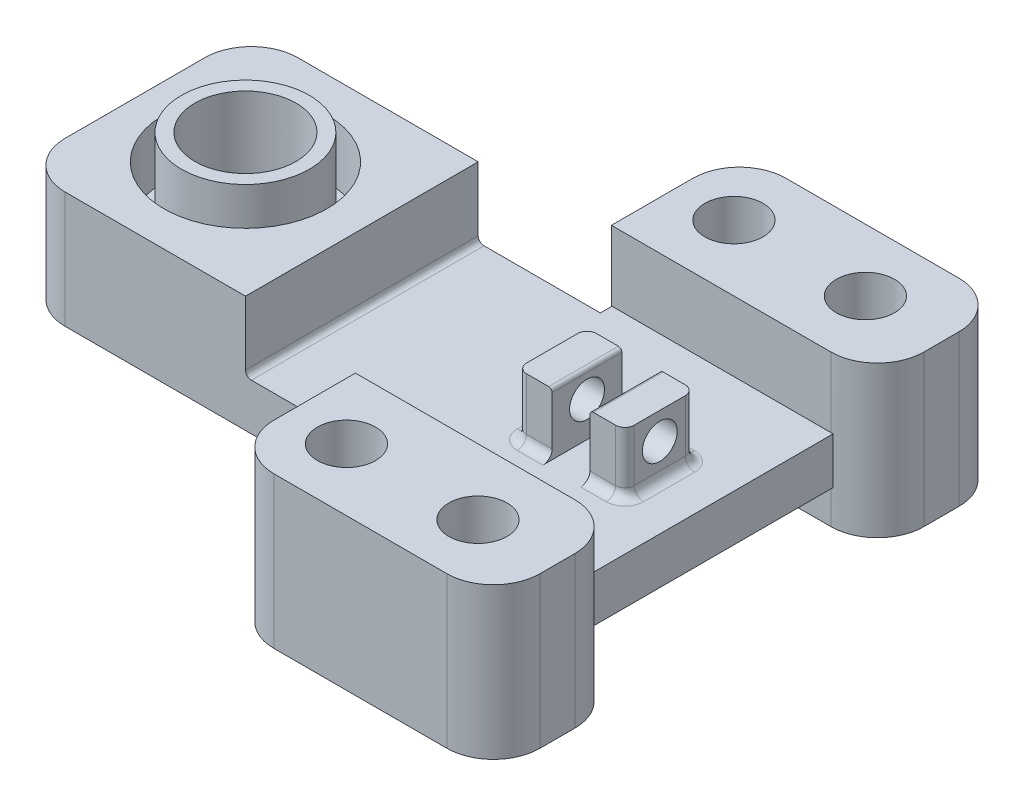
from build123d import *

# Parameters (mm, degrees)
SKETCH2_W            = 49
SKETCH2_H            = 20
BOSS_EXTRUDE1_DEPTH  = 10
SKETCH3_W            = 30
SKETCH3_H            = 3.02
CUT_EXTRUDE1_DEPTH   = 2
SKETCH4_W            = 5
SKETCH4_H            = 6
CUT_EXTRUDE2_DEPTH   = 5
SKETCH5_R            = 7
CUT_EXTRUDE3_DEPTH   = 38.474986727
SKETCH12_W           = 5
SKETCH12_H           = 6
BOSS_EXTRUDE4_DEPTH  = 0.8
SKETCH14_W           = 29.5
SKETCH14_H           = 6
CUT_EXTRUDE6_DEPTH   = 42.177221974
SKETCH20_W           = 5
SKETCH20_H           = 6
BOSS_EXTRUDE6_DEPTH  = 4.2
SKETCH21_R           = 4.6
CUT_EXTRUDE8_DEPTH   = 0.5
SKETCH22_R           = 3.825
CUT_EXTRUDE9_DEPTH   = 4
SKETCH24_R           = 4.6
SKETCH24_R_2         = 4.25
CUT_EXTRUDE11_DEPTH  = 1
BOSS_EXTRUDE9_START  = 0.5
SKETCH26_R           = 4.25
SKETCH26_R_2         = 3.825
BOSS_EXTRUDE9_DEPTH  = 0.5
SKETCH27_R           = 7
SKETCH27_R_2         = 4.6
CUT_EXTRUDE12_DEPTH  = 1
FILLET1_R            = 0.5
SKETCH56_R           = 2
CUT_EXTRUDE13_DEPTH  = 2
SKETCH57_W           = 3
SKETCH57_H           = 6
BOSS_EXTRUDE19_DEPTH = 5.3
CUT_EXTRUDE14_REACH  = 50.148
SKETCH58_R           = 1.5
FILLET2_R            = 0.3
FILLET3_R            = 0.8
SKETCH60_W           = 19
SKETCH60_H           = 4
BOSS_EXTRUDE21_DEPTH = 1
SKETCH59_W           = 22.86
SKETCH59_H           = 13
BOSS_EXTRUDE20_DEPTH = 11
CUT_EXTRUDE15_REACH  = 49.914
SKETCH61_R           = 2.5
FILLET4_R            = 4
SKETCH65_R           = 7
SKETCH65_R_2         = 4.25
BOSS_EXTRUDE24_DEPTH = 1
CUT_EXTRUDE17_REACH  = 48.805
SKETCH66_R           = 4.35
BOSS_EXTRUDE25_START = 7.2
SKETCH67_R           = 5.5
SKETCH67_R_2         = 4.35
BOSS_EXTRUDE25_DEPTH = 7.2


with BuildPart() as part:
    # Sketch2 → Boss-Extrude1 (new body)
    with BuildSketch(Plane(origin=(0, 0, 0), x_dir=(1, 0, 0), z_dir=(0, 1, 0))):
        with Locations((10.076923077, 3.557692308)):
            Rectangle(SKETCH2_W, SKETCH2_H)
    extrude(amount=BOSS_EXTRUDE1_DEPTH)

    # Sketch3 → Cut-Extrude1 (cut)
    with BuildSketch(Plane.XZ):
        with Locations((12.576923077, -3.557692308)):
            Rectangle(SKETCH3_W, SKETCH3_H)
    extrude(amount=-CUT_EXTRUDE1_DEPTH, mode=Mode.SUBTRACT)

    # Sketch4 → Cut-Extrude2 (cut)
    with BuildSketch(Plane.XZ):
        with Locations((-4.923076923, -3.547692308)):
            Rectangle(SKETCH4_W, SKETCH4_H)
    extrude(amount=-CUT_EXTRUDE2_DEPTH, mode=Mode.SUBTRACT)

    # Sketch5 → Cut-Extrude3 (cut, through all)
    with BuildSketch(Plane.XZ.offset(-5)):
        with Locations(Location((-4.923076923, -3.552692308, 0), (0, 0, 270))):
            Circle(SKETCH5_R)
    extrude(amount=-CUT_EXTRUDE3_DEPTH, mode=Mode.SUBTRACT)

    # Sketch12 → Boss-Extrude4 (add)
    with BuildSketch(Plane.XZ):
        with Locations((-4.923076923, -3.547692308)):
            Rectangle(SKETCH12_W, SKETCH12_H)
    extrude(amount=-BOSS_EXTRUDE4_DEPTH)

    # Sketch14 → Cut-Extrude6 (cut, through all)
    with BuildSketch(Plane.XY.offset(6.442307692)):
        with Locations((19.826923077, 7)):
            Rectangle(SKETCH14_W, SKETCH14_H)
    extrude(amount=-CUT_EXTRUDE6_DEPTH, mode=Mode.SUBTRACT)

    # Sketch20 → Boss-Extrude6 (add)
    with BuildSketch(Plane(origin=(0, 0.8, 0), x_dir=(1, 0, 0), z_dir=(0, 1, 0))):
        with Locations((-4.923076923, 3.547692308)):
            Rectangle(SKETCH20_W, SKETCH20_H)
    extrude(amount=BOSS_EXTRUDE6_DEPTH)

    # Sketch21 → Cut-Extrude8 (cut)
    with BuildSketch(Plane(origin=(0, 5, 0), x_dir=(1, 0, 0), z_dir=(0, 1, 0))):
        with Locations(Location((-4.923076923, 3.552692308, 0), (0, 0, 270))):
            Circle(SKETCH21_R)
    extrude(amount=-CUT_EXTRUDE8_DEPTH, mode=Mode.SUBTRACT)

    # Sketch22 → Cut-Extrude9 (cut)
    with BuildSketch(Plane(origin=(0, 4.5, 0), x_dir=(1, 0, 0), z_dir=(0, 1, 0))):
        with Locations(Location((-4.923076923, 3.552692308, 0), (0, 0, 270))):
            Circle(SKETCH22_R)
    extrude(amount=-CUT_EXTRUDE9_DEPTH, mode=Mode.SUBTRACT)

    # Sketch24 → Cut-Extrude11 (cut)
    with BuildSketch(Plane(origin=(0, 5, 0), x_dir=(1, 0, 0), z_dir=(0, 1, 0))):
        with Locations(Location((-4.923076923, 3.552692308, 0), (0, 0, 270))):
            Circle(SKETCH24_R)
        with Locations(Location((-4.923076923, 3.552692308, 0), (0, 0, 270))):
            Circle(SKETCH24_R_2, mode=Mode.SUBTRACT)
    extrude(amount=-CUT_EXTRUDE11_DEPTH, mode=Mode.SUBTRACT)

    # Sketch26 → Boss-Extrude9 (add)
    with BuildSketch(Plane(origin=(0, 4.5, 0), x_dir=(1, 0, 0), z_dir=(0, 1, 0)).offset(BOSS_EXTRUDE9_START)):
        with Locations(Location((-4.923076923, 3.552692308, 0), (0, 0, 270))):
            Circle(SKETCH26_R)
        with Locations(Location((-4.923076923, 3.552692308, 0), (0, 0, 270))):
            Circle(SKETCH26_R_2, mode=Mode.SUBTRACT)
    extrude(amount=-BOSS_EXTRUDE9_DEPTH)

    # Sketch27 → Cut-Extrude12 (cut)
    with BuildSketch(Plane(origin=(0, 5, 0), x_dir=(1, 0, 0), z_dir=(0, 1, 0))):
        with Locations(Location((-4.923076923, 3.552692308, 0), (0, 0, 90))):
            Circle(SKETCH27_R)
        with Locations((-4.923076923, 3.552692308)):
            Circle(SKETCH27_R_2, mode=Mode.SUBTRACT)
    extrude(amount=-CUT_EXTRUDE12_DEPTH, mode=Mode.SUBTRACT)

    # Fillet1
    fillet1_edges = [part.edges().sort_by_distance(p)[0] for p in [
        (5.076923077, 4, -3.557692308),
    ]]
    fillet(fillet1_edges, radius=FILLET1_R)

    # Sketch56 → Cut-Extrude13 (cut)
    with BuildSketch(Plane.XZ):
        with Locations((28.926923077, -3.557692308)):
            Circle(SKETCH56_R)
    extrude(amount=-CUT_EXTRUDE13_DEPTH, mode=Mode.SUBTRACT)

    # Sketch57 → Boss-Extrude19 (add)
    with BuildSketch(Plane(origin=(0, 4, 0), x_dir=(1, 0, 0), z_dir=(0, 1, 0))):
        with Locations((29.181923077, 3.557692308)):
            Rectangle(SKETCH57_W, SKETCH57_H)
        with Locations((22.931923077, 3.557692308)):
            Rectangle(SKETCH57_W, SKETCH57_H)
    extrude(amount=BOSS_EXTRUDE19_DEPTH)

    # Cut-Extrude14: up to this face of the body (flat: up to its plane)
    cut_extrude14_end = Plane(part.part.faces().sort_by_distance((21.431923077, 6.65, -3.557692308))[0])
    # Sketch58 → Cut-Extrude14 (cut, up to the picked face)
    with BuildSketch(Plane(origin=(30.681923077, 0, 0), x_dir=(0, 0, -1), z_dir=(1, 0, 0)), mode=Mode.PRIVATE) as cut_extrude14_sk1:
        with Locations(Location((3.557692308, 7, 0), (0, 0, 180))):
            Circle(SKETCH58_R)
    cut_extrude14_tool1 = split(extrude(cut_extrude14_sk1.sketch, amount=-CUT_EXTRUDE14_REACH, mode=Mode.PRIVATE), bisect_by=cut_extrude14_end, keep=Keep.BOTH, mode=Mode.PRIVATE)
    add(cut_extrude14_tool1.solids().sort_by(Axis((30.681923, 7, -3.557692), (-1, 0, 0)))[0], mode=Mode.SUBTRACT)

    # Fillet2
    fillet2_edges = [part.edges().sort_by_distance(p)[0] for p in [
        (27.681923077, 9.3, -3.557692308),
        (24.431923077, 9.3, -3.557692308),
    ]]
    fillet(fillet2_edges, radius=FILLET2_R)

    # Fillet3
    fillet3_edges = [part.edges().sort_by_distance(p)[0] for p in [
        (30.681923077, 4, -3.557692308),
        (30.681923077, 6.65, -0.557692308),
        (29.181923077, 4, -6.557692308),
        (30.681923077, 6.65, -6.557692308),
        (29.181923077, 4, -0.557692308),
        (21.431923077, 6.65, -6.557692308),
        (21.431923077, 6.65, -0.557692308),
        (22.931923077, 4, -6.557692308),
        (21.431923077, 4, -3.557692308),
        (22.931923077, 4, -0.557692308),
    ]]
    fillet(fillet3_edges, radius=FILLET3_R)

    # Sketch60 → Boss-Extrude21 (add)
    with BuildSketch(Plane(origin=(0, 0, -13.557692308), x_dir=(-1, 0, 0), z_dir=(0, 0, -1))):
        with Locations((-25.076923077, 2)):
            Rectangle(SKETCH60_W, SKETCH60_H)
    boss_extrude21 = extrude(amount=BOSS_EXTRUDE21_DEPTH)

    # Sketch59 → Boss-Extrude20 (add)
    with BuildSketch(Plane(origin=(0, 0, -14.557692308), x_dir=(-1, 0, 0), z_dir=(0, 0, -1))):
        with Locations((-26.956923077, 3.5)):
            Rectangle(SKETCH59_W, SKETCH59_H)
    boss_extrude20 = extrude(amount=BOSS_EXTRUDE20_DEPTH)

    # Mirror4: Boss-Extrude21, Boss-Extrude20 across plane
    add(boss_extrude21.mirror(Plane(origin=(0, 0, -3.557692308), x_dir=(1, 0, 0), z_dir=(0, 0, -1))))
    add(boss_extrude20.mirror(Plane(origin=(0, 0, -3.557692308), x_dir=(1, 0, 0), z_dir=(0, 0, -1))))

    # Sketch61 → Cut-Extrude15 (cut, up to next)
    with BuildSketch(Plane(origin=(0, 10, 0), x_dir=(1, 0, 0), z_dir=(0, 1, 0)), mode=Mode.PRIVATE) as cut_extrude15_sk1:
        with Locations(Location((20.406923077, 20.207692308, 0), (0, 0, 270))):
            Circle(SKETCH61_R)
    cut_extrude15_tool1 = extrude(cut_extrude15_sk1.sketch, amount=-CUT_EXTRUDE15_REACH, mode=Mode.PRIVATE) & part.part
    # Sketch61 → Cut-Extrude15 (cut, up to next)
    with BuildSketch(Plane(origin=(0, 10, 0), x_dir=(1, 0, 0), z_dir=(0, 1, 0)), mode=Mode.PRIVATE) as cut_extrude15_sk2:
        with Locations(Location((31.706923077, 20.207692308, 0), (0, 0, 270))):
            Circle(SKETCH61_R)
    cut_extrude15_tool2 = extrude(cut_extrude15_sk2.sketch, amount=-CUT_EXTRUDE15_REACH, mode=Mode.PRIVATE) & part.part
    # Sketch61 → Cut-Extrude15 (cut, up to next)
    with BuildSketch(Plane(origin=(0, 10, 0), x_dir=(1, 0, 0), z_dir=(0, 1, 0)), mode=Mode.PRIVATE) as cut_extrude15_sk3:
        with Locations(Location((31.706923077, -13.092307692, 0), (0, 0, 90))):
            Circle(SKETCH61_R)
    cut_extrude15_tool3 = extrude(cut_extrude15_sk3.sketch, amount=-CUT_EXTRUDE15_REACH, mode=Mode.PRIVATE) & part.part
    # Sketch61 → Cut-Extrude15 (cut, up to next)
    with BuildSketch(Plane(origin=(0, 10, 0), x_dir=(1, 0, 0), z_dir=(0, 1, 0)), mode=Mode.PRIVATE) as cut_extrude15_sk4:
        with Locations(Location((20.406923077, -13.092307692, 0), (0, 0, 90))):
            Circle(SKETCH61_R)
    cut_extrude15_tool4 = extrude(cut_extrude15_sk4.sketch, amount=-CUT_EXTRUDE15_REACH, mode=Mode.PRIVATE) & part.part
    add(cut_extrude15_tool1.solids().sort_by_distance((20.406923, 10, -20.207692))[0], mode=Mode.SUBTRACT)
    add(cut_extrude15_tool2.solids().sort_by_distance((31.706923, 10, -20.207692))[0], mode=Mode.SUBTRACT)
    add(cut_extrude15_tool3.solids().sort_by_distance((31.706923, 10, 13.092308))[0], mode=Mode.SUBTRACT)
    add(cut_extrude15_tool4.solids().sort_by_distance((20.406923, 10, 13.092308))[0], mode=Mode.SUBTRACT)

    # Fillet4
    # the kernel refuses this fillet: 4 mm, written as the material it takes off along each edge
    with BuildSketch(Plane(origin=(38.386923077, 20, -25.557692308), x_dir=(0, 0, 1), z_dir=(0, -1, 0)), Plane(origin=(15.526923077, -13, 18.442307692), x_dir=(1, 0, 0), z_dir=(0, 1, 0)), Plane(origin=(15.526923077, -13, -25.557692308), x_dir=(0, 0, 1), z_dir=(0, 1, 0))) as fillet4_piece_1:
        with BuildLine():
            CenterArc((FILLET4_R, FILLET4_R), FILLET4_R, 180, 90)
            Line((0, FILLET4_R), (0, 0))
            Line((0, 0), (FILLET4_R, 0))
        make_face()
    extrude(amount=33, mode=Mode.SUBTRACT)
    with BuildSketch(Plane(origin=(38.386923077, 20, 7.442307692), x_dir=(0, 0, 1), z_dir=(0, -1, 0))) as fillet4_piece_2_section:
        with BuildLine():
            CenterArc((FILLET4_R, FILLET4_R), FILLET4_R, 180, 90)
            Line((0, FILLET4_R), (0, 0))
            Line((0, 0), (FILLET4_R, 0))
        make_face()
    fillet4_piece_2 = extrude(amount=33, mode=Mode.PRIVATE)
    fillet4_piece_2 = split(fillet4_piece_2, bisect_by=Plane(origin=(34.576923077, 12, 8.351487897), z_dir=(1, 0, 0)), keep=Keep.TOP, mode=Mode.PRIVATE)
    fillet4_piece_2 = split(fillet4_piece_2, bisect_by=Plane(origin=(37.49276705, 4, 8.351487897), z_dir=(0, 1, 0)), keep=Keep.TOP, mode=Mode.PRIVATE)
    add(fillet4_piece_2, mode=Mode.SUBTRACT)
    with BuildSketch(Plane(origin=(38.386923077, 20, 7.442307692), x_dir=(0, 0, 1), z_dir=(0, -1, 0))) as fillet4_piece_3_section:
        with BuildLine():
            CenterArc((FILLET4_R, FILLET4_R), FILLET4_R, 180, 90)
            Line((0, FILLET4_R), (0, 0))
            Line((0, 0), (FILLET4_R, 0))
        make_face()
    fillet4_piece_3 = extrude(amount=33, mode=Mode.PRIVATE)
    fillet4_piece_3 = split(fillet4_piece_3, bisect_by=Plane(origin=(34.576923077, 12, 7.403071145), z_dir=(-1, 0, 0)), keep=Keep.TOP, mode=Mode.PRIVATE)
    fillet4_piece_3 = split(fillet4_piece_3, bisect_by=Plane(origin=(34.482800084, 4, 7.403071145), z_dir=(0, 1, 0)), keep=Keep.TOP, mode=Mode.PRIVATE)
    add(fillet4_piece_3, mode=Mode.SUBTRACT)
    with BuildSketch(Plane(origin=(38.386923077, 20, 7.442307692), x_dir=(0, 0, 1), z_dir=(0, -1, 0))) as fillet4_piece_4_section:
        with BuildLine():
            CenterArc((FILLET4_R, FILLET4_R), FILLET4_R, 180, 90)
            Line((0, FILLET4_R), (0, 0))
            Line((0, 0), (FILLET4_R, 0))
        make_face()
    fillet4_piece_4 = extrude(amount=33, mode=Mode.PRIVATE)
    fillet4_piece_4 = split(fillet4_piece_4, bisect_by=Plane(origin=(34.576923077, 2, 8.351487897), z_dir=(1, 0, 0)), keep=Keep.TOP, mode=Mode.PRIVATE)
    fillet4_piece_4 = split(fillet4_piece_4, bisect_by=Plane(origin=(37.49276705, 0, 8.351487897), z_dir=(0, 1, 0)), keep=Keep.TOP, mode=Mode.PRIVATE)
    fillet4_piece_4 = split(fillet4_piece_4, bisect_by=Plane(origin=(37.49276705, 4, 8.351487897), z_dir=(0, -1, 0)), keep=Keep.TOP, mode=Mode.PRIVATE)
    add(fillet4_piece_4, mode=Mode.SUBTRACT)
    with BuildSketch(Plane(origin=(38.386923077, 20, 7.442307692), x_dir=(0, 0, 1), z_dir=(0, -1, 0))) as fillet4_piece_5_section:
        with BuildLine():
            CenterArc((FILLET4_R, FILLET4_R), FILLET4_R, 180, 90)
            Line((0, FILLET4_R), (0, 0))
            Line((0, 0), (FILLET4_R, 0))
        make_face()
    fillet4_piece_5 = extrude(amount=33, mode=Mode.PRIVATE)
    fillet4_piece_5 = split(fillet4_piece_5, bisect_by=Plane(origin=(34.576923077, -6.5, 8.351487897), z_dir=(1, 0, 0)), keep=Keep.TOP, mode=Mode.PRIVATE)
    fillet4_piece_5 = split(fillet4_piece_5, bisect_by=Plane(origin=(37.49276705, 0, 8.351487897), z_dir=(0, -1, 0)), keep=Keep.TOP, mode=Mode.PRIVATE)
    add(fillet4_piece_5, mode=Mode.SUBTRACT)
    with BuildSketch(Plane(origin=(38.386923077, 20, 7.442307692), x_dir=(0, 0, 1), z_dir=(0, -1, 0))) as fillet4_piece_6_section:
        with BuildLine():
            CenterArc((FILLET4_R, FILLET4_R), FILLET4_R, 180, 90)
            Line((0, FILLET4_R), (0, 0))
            Line((0, 0), (FILLET4_R, 0))
        make_face()
    fillet4_piece_6 = extrude(amount=33, mode=Mode.PRIVATE)
    fillet4_piece_6 = split(fillet4_piece_6, bisect_by=Plane(origin=(34.576923077, -6.5, 7.403071145), z_dir=(-1, 0, 0)), keep=Keep.TOP, mode=Mode.PRIVATE)
    fillet4_piece_6 = split(fillet4_piece_6, bisect_by=Plane(origin=(34.482800084, 0, 7.403071145), z_dir=(0, -1, 0)), keep=Keep.TOP, mode=Mode.PRIVATE)
    add(fillet4_piece_6, mode=Mode.SUBTRACT)
    with BuildSketch(Plane(origin=(38.386923077, 20, 18.442307692), x_dir=(0, 0, -1), z_dir=(0, -1, 0))) as fillet4_piece_7:
        with BuildLine():
            CenterArc((FILLET4_R, -FILLET4_R), FILLET4_R, 90, 90)
            Line((0, -FILLET4_R), (0, 0))
            Line((0, 0), (FILLET4_R, 0))
        make_face()
    extrude(amount=33, mode=Mode.SUBTRACT)
    with BuildSketch(Plane(origin=(-14.423076923, -10, -13.557692308), x_dir=(1, 0, 0), z_dir=(0, 1, 0))) as fillet4_piece_8:
        with BuildLine():
            CenterArc((FILLET4_R, -FILLET4_R), FILLET4_R, 90, 90)
            Line((0, -FILLET4_R), (0, 0))
            Line((0, 0), (FILLET4_R, 0))
        make_face()
    extrude(amount=30, mode=Mode.SUBTRACT)
    with BuildSketch(Plane(origin=(-14.423076923, -10, 6.442307692), x_dir=(1, 0, 0), z_dir=(0, 1, 0))) as fillet4_piece_9:
        with BuildLine():
            CenterArc((FILLET4_R, FILLET4_R), FILLET4_R, 180, 90)
            Line((0, FILLET4_R), (0, 0))
            Line((0, 0), (FILLET4_R, 0))
        make_face()
    extrude(amount=30, mode=Mode.SUBTRACT)
    with BuildSketch(Plane(origin=(38.386923077, 20, -14.557692308), x_dir=(-1, 0, 0), z_dir=(0, -1, 0))) as fillet4_piece_10_section:
        with BuildLine():
            CenterArc((FILLET4_R, FILLET4_R), FILLET4_R, 180, 90)
            Line((0, FILLET4_R), (0, 0))
            Line((0, 0), (FILLET4_R, 0))
        make_face()
    fillet4_piece_10 = extrude(amount=33, mode=Mode.PRIVATE)
    fillet4_piece_10 = split(fillet4_piece_10, bisect_by=Plane(origin=(34.576923077, 12, -14.51845576), z_dir=(-1, 0, 0)), keep=Keep.TOP, mode=Mode.PRIVATE)
    fillet4_piece_10 = split(fillet4_piece_10, bisect_by=Plane(origin=(34.482800084, 4, -14.51845576), z_dir=(0, 1, 0)), keep=Keep.TOP, mode=Mode.PRIVATE)
    add(fillet4_piece_10, mode=Mode.SUBTRACT)
    with BuildSketch(Plane(origin=(38.386923077, 20, -14.557692308), x_dir=(-1, 0, 0), z_dir=(0, -1, 0))) as fillet4_piece_11_section:
        with BuildLine():
            CenterArc((FILLET4_R, FILLET4_R), FILLET4_R, 180, 90)
            Line((0, FILLET4_R), (0, 0))
            Line((0, 0), (FILLET4_R, 0))
        make_face()
    fillet4_piece_11 = extrude(amount=33, mode=Mode.PRIVATE)
    fillet4_piece_11 = split(fillet4_piece_11, bisect_by=Plane(origin=(34.576923077, 12, -15.466872512), z_dir=(1, 0, 0)), keep=Keep.TOP, mode=Mode.PRIVATE)
    fillet4_piece_11 = split(fillet4_piece_11, bisect_by=Plane(origin=(37.49276705, 4, -15.466872512), z_dir=(0, 1, 0)), keep=Keep.TOP, mode=Mode.PRIVATE)
    add(fillet4_piece_11, mode=Mode.SUBTRACT)
    with BuildSketch(Plane(origin=(38.386923077, 20, -14.557692308), x_dir=(-1, 0, 0), z_dir=(0, -1, 0))) as fillet4_piece_12_section:
        with BuildLine():
            CenterArc((FILLET4_R, FILLET4_R), FILLET4_R, 180, 90)
            Line((0, FILLET4_R), (0, 0))
            Line((0, 0), (FILLET4_R, 0))
        make_face()
    fillet4_piece_12 = extrude(amount=33, mode=Mode.PRIVATE)
    fillet4_piece_12 = split(fillet4_piece_12, bisect_by=Plane(origin=(34.576923077, 2, -15.466872512), z_dir=(1, 0, 0)), keep=Keep.TOP, mode=Mode.PRIVATE)
    fillet4_piece_12 = split(fillet4_piece_12, bisect_by=Plane(origin=(37.49276705, 0, -15.466872512), z_dir=(0, 1, 0)), keep=Keep.TOP, mode=Mode.PRIVATE)
    fillet4_piece_12 = split(fillet4_piece_12, bisect_by=Plane(origin=(37.49276705, 4, -15.466872512), z_dir=(0, -1, 0)), keep=Keep.TOP, mode=Mode.PRIVATE)
    add(fillet4_piece_12, mode=Mode.SUBTRACT)
    with BuildSketch(Plane(origin=(38.386923077, 20, -14.557692308), x_dir=(-1, 0, 0), z_dir=(0, -1, 0))) as fillet4_piece_13_section:
        with BuildLine():
            CenterArc((FILLET4_R, FILLET4_R), FILLET4_R, 180, 90)
            Line((0, FILLET4_R), (0, 0))
            Line((0, 0), (FILLET4_R, 0))
        make_face()
    fillet4_piece_13 = extrude(amount=33, mode=Mode.PRIVATE)
    fillet4_piece_13 = split(fillet4_piece_13, bisect_by=Plane(origin=(34.576923077, -6.5, -14.51845576), z_dir=(-1, 0, 0)), keep=Keep.TOP, mode=Mode.PRIVATE)
    fillet4_piece_13 = split(fillet4_piece_13, bisect_by=Plane(origin=(34.482800084, 0, -14.51845576), z_dir=(0, -1, 0)), keep=Keep.TOP, mode=Mode.PRIVATE)
    add(fillet4_piece_13, mode=Mode.SUBTRACT)
    with BuildSketch(Plane(origin=(38.386923077, 20, -14.557692308), x_dir=(-1, 0, 0), z_dir=(0, -1, 0))) as fillet4_piece_14_section:
        with BuildLine():
            CenterArc((FILLET4_R, FILLET4_R), FILLET4_R, 180, 90)
            Line((0, FILLET4_R), (0, 0))
            Line((0, 0), (FILLET4_R, 0))
        make_face()
    fillet4_piece_14 = extrude(amount=33, mode=Mode.PRIVATE)
    fillet4_piece_14 = split(fillet4_piece_14, bisect_by=Plane(origin=(34.576923077, -6.5, -15.466872512), z_dir=(1, 0, 0)), keep=Keep.TOP, mode=Mode.PRIVATE)
    fillet4_piece_14 = split(fillet4_piece_14, bisect_by=Plane(origin=(37.49276705, 0, -15.466872512), z_dir=(0, -1, 0)), keep=Keep.TOP, mode=Mode.PRIVATE)
    add(fillet4_piece_14, mode=Mode.SUBTRACT)

    # Sketch65 → Boss-Extrude24 (add)
    with BuildSketch(Plane(origin=(0, 4, 0), x_dir=(1, 0, 0), z_dir=(0, 1, 0))):
        with Locations(Location((-4.923076923, 3.552692308, 0), (0, 0, 90))):
            Circle(SKETCH65_R)
        with Locations((-4.923076923, 3.552692308)):
            Circle(SKETCH65_R_2, mode=Mode.SUBTRACT)
    extrude(amount=BOSS_EXTRUDE24_DEPTH)

    # Cut-Extrude17: up to this face of the body (flat: up to its plane)
    cut_extrude17_end = Plane(part.part.faces().sort_by_distance((-5.195307942, 0.5, -3.552329957))[0])
    # Sketch66 → Cut-Extrude17 (cut, up to the picked face)
    with BuildSketch(Plane(origin=(0, 5, 0), x_dir=(1, 0, 0), z_dir=(0, 1, 0)), mode=Mode.PRIVATE) as cut_extrude17_sk1:
        with Locations(Location((-4.923076923, 3.552692308, 0), (0, 0, 270))):
            Circle(SKETCH66_R)
    cut_extrude17_tool1 = split(extrude(cut_extrude17_sk1.sketch, amount=-CUT_EXTRUDE17_REACH, mode=Mode.PRIVATE), bisect_by=cut_extrude17_end, keep=Keep.BOTH, mode=Mode.PRIVATE)
    add(cut_extrude17_tool1.solids().sort_by(Axis((-4.923077, 5, -3.552692), (0, -1, 0)))[0], mode=Mode.SUBTRACT)

    # Sketch67 → Boss-Extrude25 (add)
    with BuildSketch(Plane(origin=(0, 5, 0), x_dir=(1, 0, 0), z_dir=(0, 1, 0)).offset(BOSS_EXTRUDE25_START)):
        with Locations(Location((-4.923076923, 3.552692308, 0), (0, 0, 270))):
            Circle(SKETCH67_R)
        with Locations(Location((-4.923076923, 3.552692308, 0), (0, 0, 270))):
            Circle(SKETCH67_R_2, mode=Mode.SUBTRACT)
    extrude(amount=-BOSS_EXTRUDE25_DEPTH)


solid = part.part
